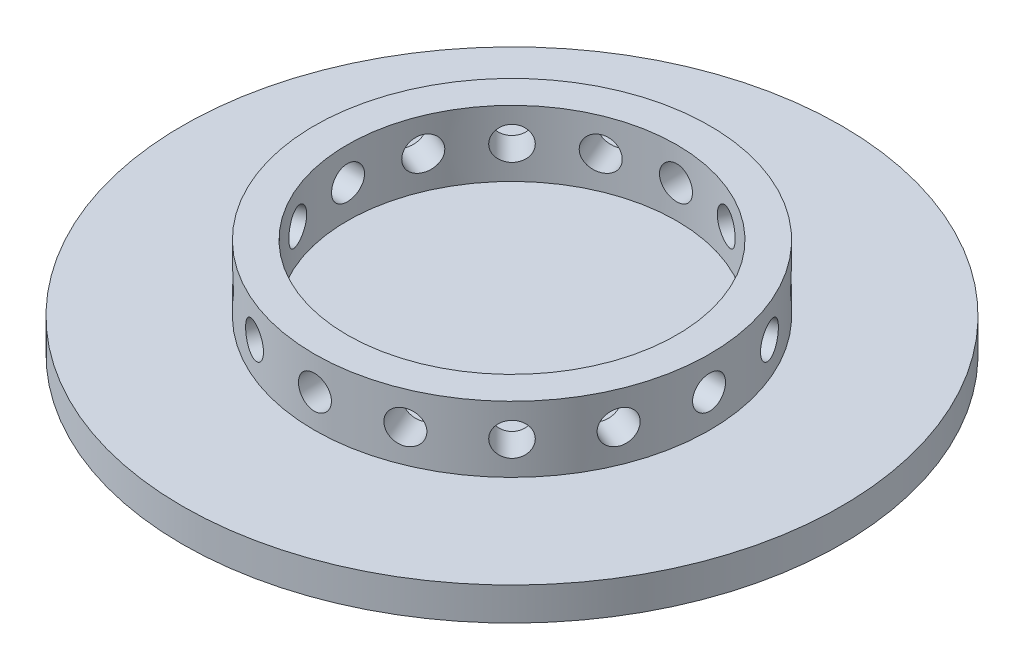
from build123d import *

# Parameters (mm, degrees)
CIRPATTERN1_COUNT = 16


with BuildPart() as part:
    # Sketch1 → Revolve1 (revolve)
    with BuildSketch(Plane.XY):
        Polygon((0, 0), (-58.3565, 0), (-58.3565, 2.54), (-61.9125, 2.54), (-61.9125, 0), (-63.5, 0), (-63.5, 6.35), (-38.1, 6.35), (-38.1, 19.05), (-31.75, 19.05), (-31.75, 6.35), (0, 6.35), align=None)
    revolve(axis=Axis((0, 6.35, 0), (0, -1, 0)))

    # Sketch3 → 1/4 (0.25) Diameter Hole1 (revolve, cut)
    with BuildSketch(Plane(origin=(38.1, 12.7, 0), x_dir=(0, 0, -1), z_dir=(0, 1, 0))):
        Polygon((0, 0), (0, 40.006732465), (3.175, 38.099), (3.175, 0), align=None)
    f_1_4_0_25_diameter_hole1 = revolve(axis=Axis((44.45, 12.7, 0), (-1, 0, 0)), mode=Mode.SUBTRACT)

    # CirPattern1: 1/4 (0.25) Diameter Hole1 ×16 about axis
    cirpattern1_axis = Axis((0, 6.35, 0), (0, 1, 0))
    for i in range(1, CIRPATTERN1_COUNT):
        add(f_1_4_0_25_diameter_hole1.rotate(cirpattern1_axis, i * 360 / CIRPATTERN1_COUNT), mode=Mode.SUBTRACT)


solid = part.part
